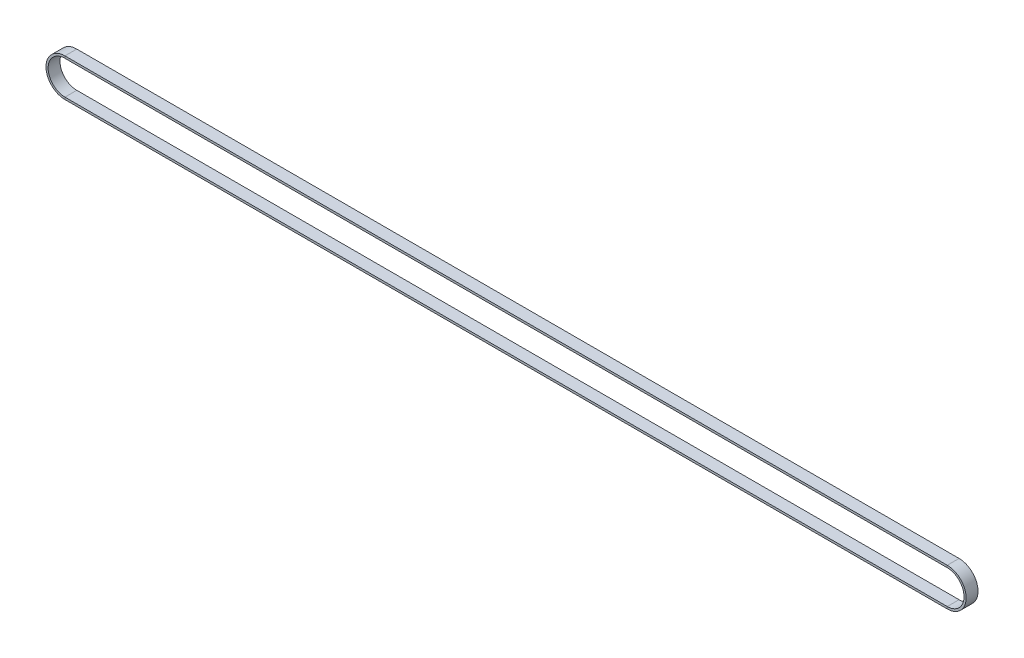
from build123d import *

# Parameters (mm, degrees)
SKETCH3_W = 6.35
SKETCH3_H = 1.143


with BuildPart() as part:
    # Sweep1: sweep along a path in Sketch2
    with BuildLine(Plane.XY) as sweep1_path:
        Line((17.4625, 3.801312013), (491.00391864, 3.801312013))
        ThreePointArc((491.00391864, 3.801312013), (501.16391864, -6.358687987), (491.00391864, -16.518687987))
        Line((491.00391864, -16.518687987), (17.4625, -16.518687987))
        ThreePointArc((17.4625, -16.518687987), (7.3025, -6.358687987), (17.4625, 3.801312013))
    # Sketch3 → Sweep1 (sweep)
    with BuildSketch(Plane(origin=(17.4625, 3.801312013, 0), x_dir=(0, 0, -1), z_dir=(1, 0, 0))):
        with Locations((0, -0.5715)):
            Rectangle(SKETCH3_W, SKETCH3_H)
    sweep(path=sweep1_path.line)


solid = part.part
